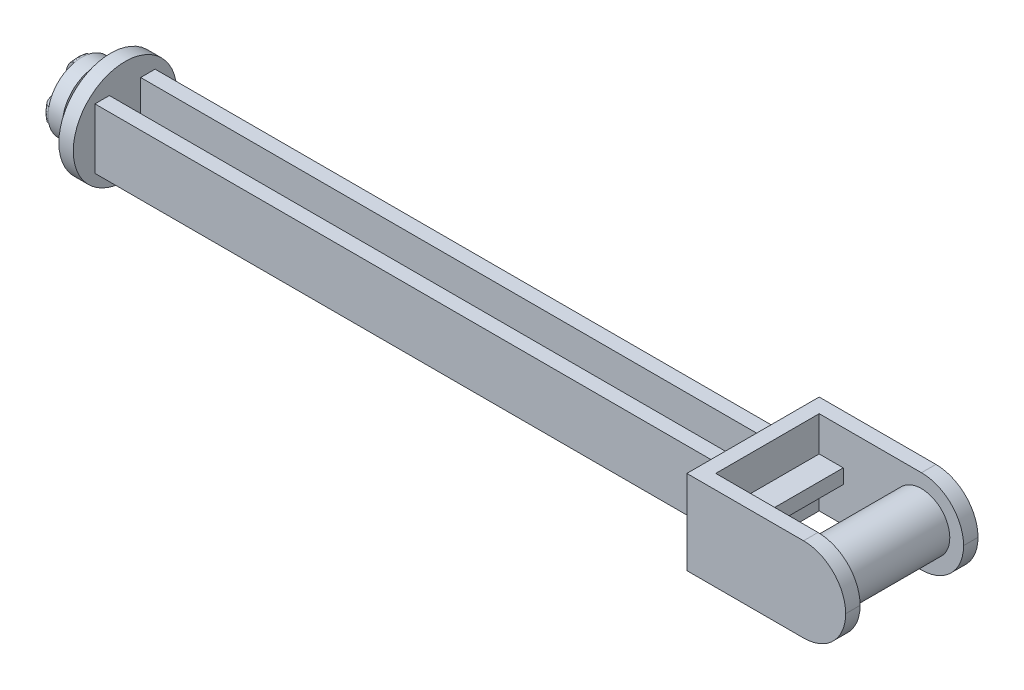
from build123d import *

# Parameters (mm, degrees)
SKETCH5_W            = 5
SKETCH5_H            = 5
BOSS_EXTRUDE3_DEPTH  = 52.2
SKETCH6_R            = 4.3
BOSS_EXTRUDE4_DEPTH  = 1.2
SKETCH7_W            = 4
SKETCH7_H            = 1.2
SKETCH7_W_2          = 1.2
SKETCH7_H_2          = 4
BOSS_EXTRUDE5_DEPTH  = 1.2
SKETCH8_R            = 2.8
BOSS_EXTRUDE6_DEPTH  = 1.2
SKETCH9_W            = 1.2
SKETCH9_H            = 1.2
BOSS_EXTRUDE7_DEPTH  = 0.8
FILLET1_SIZE         = 0.8
FILLET1_SIZE_2       = 1.8
SKETCH11_W           = 52.2
SKETCH11_H           = 2.6
CUT_EXTRUDE1_DEPTH   = 4
SKETCH12_W           = 11
SKETCH12_H           = 7
BOSS_EXTRUDE8_DEPTH  = 1.2
SKETCH13_W           = 1.2
SKETCH13_H           = 7
BOSS_EXTRUDE9_DEPTH  = 12
SKETCH14_W           = 8.6
SKETCH14_H           = 1.2
BOSS_EXTRUDE10_DEPTH = 2
FILLET2_R            = 3.5
SKETCH15_R           = 2.356317331
BOSS_EXTRUDE11_DEPTH = 8.6


# Some blends are built 0.0001 mm under size
with BuildPart() as part:
    # Sketch5 → Boss-Extrude3 (new body)
    with BuildSketch(Plane(origin=(0, 0, 0), x_dir=(0, 0, -1), z_dir=(1, 0, 0))):
        Rectangle(SKETCH5_W, SKETCH5_H)
    extrude(amount=BOSS_EXTRUDE3_DEPTH)

    # Sketch6 → Boss-Extrude4 (add)
    with BuildSketch(Plane.ZY):
        Circle(SKETCH6_R)
    extrude(amount=BOSS_EXTRUDE4_DEPTH)

    # Sketch7 → Boss-Extrude5 (add)
    with BuildSketch(Plane.ZY.offset(1.2)):
        Rectangle(SKETCH7_W, SKETCH7_H)
        Rectangle(SKETCH7_W_2, SKETCH7_H_2)
    extrude(amount=BOSS_EXTRUDE5_DEPTH)

    # Sketch8 → Boss-Extrude6 (add)
    with BuildSketch(Plane.ZY.offset(2.4)):
        Circle(SKETCH8_R)
    extrude(amount=BOSS_EXTRUDE6_DEPTH)

    # Sketch9 → Boss-Extrude7 (add)
    with BuildSketch(Plane.ZY.offset(3.6)):
        with BuildLine():
            Line((-0.6, 0.6), (0.6, 0.6))
            Line((0.6, 0.6), (0.6, 2.734958866))
            ThreePointArc((0.6, 2.734958866), (0.301757492, 2.783692227), (-1.1e-08, 2.8))
            ThreePointArc((-1.1e-08, 2.8), (-0.301757503, 2.783692226), (-0.6, 2.734958866))
            Line((-0.6, 2.734958866), (-0.6, 0.6))
        make_face()
        with BuildLine():
            Line((-2.734958866, -0.6), (-0.6, -0.6))
            Line((-0.6, -0.6), (-0.6, 0.6))
            Line((-0.6, 0.6), (-2.734958866, 0.6))
            ThreePointArc((-2.734958866, 0.6), (-2.783692227, 0.301757497), (-2.8, 0))
            ThreePointArc((-2.8, 0), (-2.783692227, -0.301757497), (-2.734958866, -0.6))
        make_face()
        Rectangle(SKETCH9_W, SKETCH9_H)
        with BuildLine():
            Line((0.6, -2.734958866), (0.6, -0.6))
            Line((0.6, -0.6), (-0.6, -0.6))
            Line((-0.6, -0.6), (-0.6, -2.734958866))
            ThreePointArc((-0.6, -2.734958866), (-0.301757497, -2.783692227), (0, -2.8))
            ThreePointArc((0, -2.8), (0.301757497, -2.783692227), (0.6, -2.734958866))
        make_face()
        with BuildLine():
            Line((0.6, -0.6), (2.734958866, -0.6))
            ThreePointArc((2.734958866, -0.6), (2.783692227, -0.301757497), (2.8, 0))
            ThreePointArc((2.8, 0), (2.783692227, 0.301757497), (2.734958866, 0.6))
            Line((2.734958866, 0.6), (0.6, 0.6))
            Line((0.6, 0.6), (0.6, -0.6))
        make_face()
    extrude(amount=BOSS_EXTRUDE7_DEPTH)

    # Fillet1
    # an asymmetric fillet: 1.8, 0.8 mm, written as the material it takes off along each edge
    with BuildSketch(Plane(origin=(-4.4, 0, 0), x_dir=(0, 0.24968586276301843, 0.9683268920856671), z_dir=(0, 0.9683268920856671, -0.24968586276301843))) as fillet1_piece_1:
        with BuildLine():
            Bezier((2.8, FILLET1_SIZE), (2.8, 0), (2.8 - FILLET1_SIZE_2, 0), weights=[1, 0.707106781, 1])
            Line((2.8 - FILLET1_SIZE_2, 0), (2.8, 0))
            Line((2.8, 0), (2.8, FILLET1_SIZE))
        make_face()
    revolve(axis=Axis((-4.4, 0, 0), (1, 0, 0)), revolution_arc=208.917847895, mode=Mode.SUBTRACT)
    with BuildSketch(Plane(origin=(-4.4, 0, 0), x_dir=(0, -0.2496858627630699, -0.9683268920856537), z_dir=(0, -0.9683268920856537, 0.2496858627630699))) as fillet1_piece_2:
        with BuildLine():
            Bezier((2.8, FILLET1_SIZE), (2.8, 0), (2.8 - FILLET1_SIZE_2, 0), weights=[1, 0.707106781, 1])
            Line((2.8 - FILLET1_SIZE_2, 0), (2.8, 0))
            Line((2.8, 0), (2.8, FILLET1_SIZE))
        make_face()
    revolve(axis=Axis((-4.4, 0, 0), (1, 0, 0)), revolution_arc=208.917847895, mode=Mode.SUBTRACT)
    with BuildSketch(Plane(origin=(-4.4, 0, 0), x_dir=(0, 0.9683268920856462, -0.24968586276309931), z_dir=(0, -0.24968586276309931, -0.9683268920856462))) as fillet1_piece_3:
        with BuildLine():
            Bezier((2.8, FILLET1_SIZE), (2.8, 0), (2.8 - FILLET1_SIZE_2, 0), weights=[1, 0.707106781, 1])
            Line((2.8 - FILLET1_SIZE_2, 0), (2.8, 0))
            Line((2.8, 0), (2.8, FILLET1_SIZE))
        make_face()
    revolve(axis=Axis((-4.4, 0, 0), (1, 0, 0)), revolution_arc=208.917847895, mode=Mode.SUBTRACT)
    with BuildSketch(Plane(origin=(-4.4, 0, 0), x_dir=(0, -0.968326892085652, 0.24968586276307686), z_dir=(0, 0.24968586276307686, 0.968326892085652))) as fillet1_piece_4:
        with BuildLine():
            Bezier((2.8, FILLET1_SIZE), (2.8, 0), (2.8 - FILLET1_SIZE_2, 0), weights=[1, 0.707106781, 1])
            Line((2.8 - FILLET1_SIZE_2, 0), (2.8, 0))
            Line((2.8, 0), (2.8, FILLET1_SIZE))
        make_face()
    revolve(axis=Axis((-4.4, 0, 0), (1, 0, 0)), revolution_arc=208.917847895, mode=Mode.SUBTRACT)

    # Sketch11 → Cut-Extrude1 (cut)
    with BuildSketch(Plane(origin=(0, 2.5, 0), x_dir=(1, 0, 0), z_dir=(0, 1, 0))):
        with Locations((26.1, 0)):
            Rectangle(SKETCH11_W, SKETCH11_H)
    extrude(amount=-CUT_EXTRUDE1_DEPTH, mode=Mode.SUBTRACT)

    # Sketch12 → Boss-Extrude8 (add)
    with BuildSketch(Plane(origin=(52.2, 0, 0), x_dir=(0, 0, -1), z_dir=(1, 0, 0))):
        Rectangle(SKETCH12_W, SKETCH12_H)
    extrude(amount=BOSS_EXTRUDE8_DEPTH)

    # Sketch13 → Boss-Extrude9 (add)
    with BuildSketch(Plane(origin=(53.4, 0, 0), x_dir=(0, 0, -1), z_dir=(1, 0, 0))):
        with Locations((-4.9, 0)):
            Rectangle(SKETCH13_W, SKETCH13_H)
        with Locations((4.9, 0)):
            Rectangle(SKETCH13_W, SKETCH13_H)
    extrude(amount=BOSS_EXTRUDE9_DEPTH)

    # Sketch14 → Boss-Extrude10 (add)
    with BuildSketch(Plane(origin=(53.4, 0, 0), x_dir=(0, 0, -1), z_dir=(1, 0, 0))):
        Rectangle(SKETCH14_W, SKETCH14_H)
    extrude(amount=BOSS_EXTRUDE10_DEPTH)

    # Fillet2
    fillet2_edges = [part.edges().sort_by_distance(p)[0] for p in [
        (65.4, -3.5, 4.9),
        (65.4, 3.5, 4.9),
        (65.4, 3.5, -4.9),
        (65.4, -3.5, -4.9),
    ]]
    fillet(fillet2_edges, radius=FILLET2_R - 0.0001)  # a hair under: the kernel refuses the full size

    # Sketch15 → Boss-Extrude11 (add)
    with BuildSketch(Plane(origin=(0, 0, 4.3), x_dir=(-1, 0, 0), z_dir=(0, 0, -1))):
        with Locations(Location((-61.9, 0, 0), (0, 0, 180))):
            Circle(SKETCH15_R)
    extrude(amount=BOSS_EXTRUDE11_DEPTH)


solid = part.part
